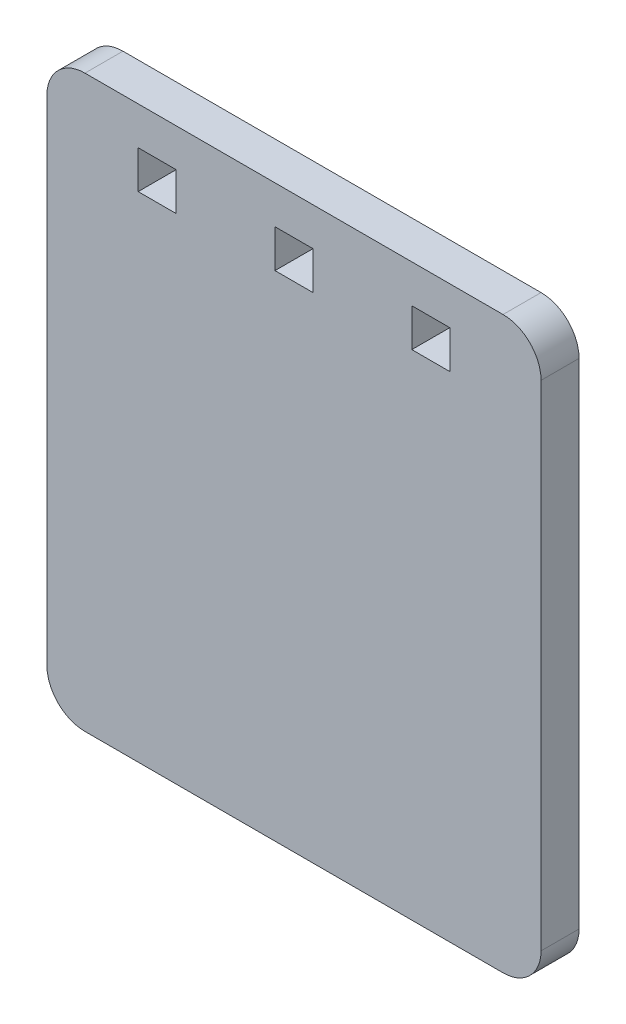
from build123d import *

# Parameters (mm, degrees)
SKETCH_1_W          = 65
SKETCH_1_H          = 75
EXTRUDE_1_DEPTH     = 5
SKETCH_2_W          = 5
SKETCH_2_H          = 5
CUT_EXTRUDE_1_DEPTH = 5
FILLET_1_R          = 5


with BuildPart() as part:
    # 草图1 → 凸台-拉伸1 (new body)
    with BuildSketch(Plane.XY):
        with Locations((32.5, -37.5)):
            Rectangle(SKETCH_1_W, SKETCH_1_H)
    extrude(amount=EXTRUDE_1_DEPTH)

    # 草图2 → 切除-拉伸1 (cut)
    with BuildSketch(Plane.XY.offset(5)):
        with Locations((14.5, -7.5)):
            Rectangle(SKETCH_2_W, SKETCH_2_H)
        with Locations((32.5, -7.5)):
            Rectangle(SKETCH_2_W, SKETCH_2_H)
        with Locations((50.5, -7.5)):
            Rectangle(SKETCH_2_W, SKETCH_2_H)
    extrude(amount=-CUT_EXTRUDE_1_DEPTH, mode=Mode.SUBTRACT)

    # 圆角1
    fillet_1_edges = [part.edges().sort_by_distance(p)[0] for p in [
        (0, -75, 2.5),
        (65, -75, 2.5),
        (65, 0, 2.5),
        (0, 0, 2.5),
    ]]
    fillet(fillet_1_edges, radius=FILLET_1_R)


solid = part.part
